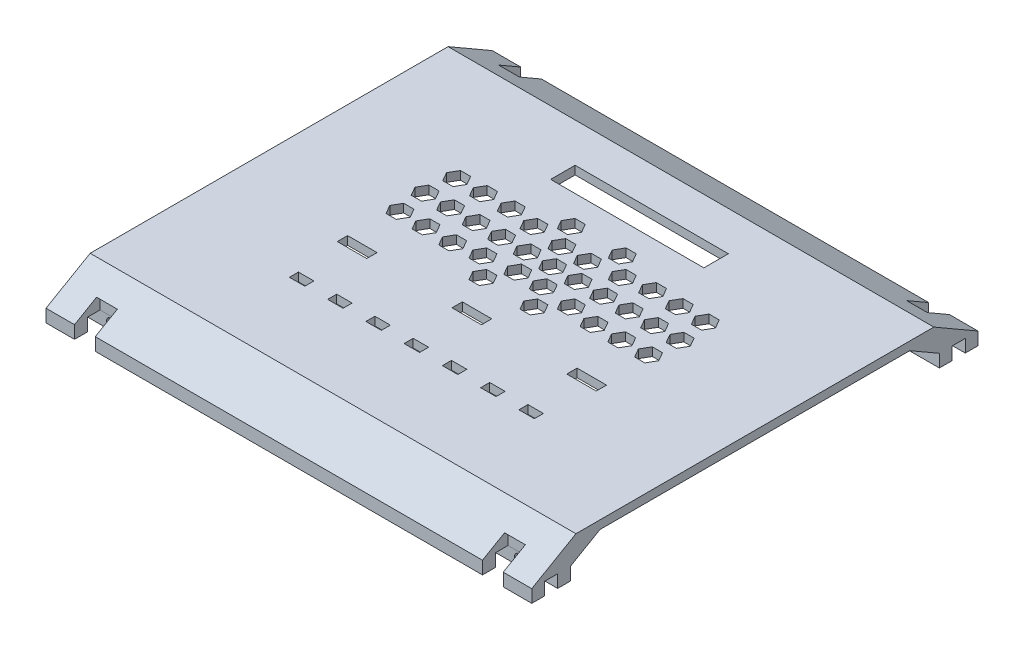
from build123d import *
from OCP.BRepFilletAPI import BRepFilletAPI_MakeChamfer

# Parameters (mm, degrees)
SKETCH1_W           = 190.5
SKETCH1_H           = 175
BOSS_EXTRUDE1_DEPTH = 10
SKETCH2_W           = 190.5
SKETCH2_H           = 5
BOSS_EXTRUDE2_DEPTH = 5
CHAMFER1_SIZE       = 10
CHAMFER1_SIZE2      = 17.320508076
CUT_EXTRUDE1_DEPTH  = 190.5
SKETCH4_R           = 1.65
CUT_EXTRUDE2_DEPTH  = 200.493264297
SKETCH6_W           = 8.137310982
SKETCH6_H           = 10
CUT_EXTRUDE4_DEPTH  = 10
SKETCH7_W           = 6.05
SKETCH7_H           = 3.55
CUT_EXTRUDE5_DEPTH  = 10
LPATTERN1_COUNT     = 7
LPATTERN1_PITCH     = 15
SKETCH8_W           = 11.55
SKETCH8_H           = 4.05
CUT_EXTRUDE6_DEPTH  = 3.301548091
SKETCH9_W           = 60.1
SKETCH9_H           = 9.6
CUT_EXTRUDE7_DEPTH  = 3.301548091
FILL_START          = 6.698451909
FILL_PATTERN1_DEPTH = 3.301548091


# Read off the part's stored shape, not the designer's step: Fill Pattern1
with BuildPart() as part:
    # Sketch1 → Boss-Extrude1 (new body)
    with BuildSketch(Plane(origin=(0, 0, 0), x_dir=(1, 0, 0), z_dir=(0, 1, 0))):
        Rectangle(SKETCH1_W, SKETCH1_H)
    extrude(amount=BOSS_EXTRUDE1_DEPTH)

    # Sketch2 → Boss-Extrude2 (add)
    with BuildSketch(Plane.XZ):
        with Locations((0, 85)):
            Rectangle(SKETCH2_W, SKETCH2_H)
        with Locations((0, 74.85)):
            Rectangle(SKETCH2_W, SKETCH2_H)
    boss_extrude2 = extrude(amount=BOSS_EXTRUDE2_DEPTH)

    # Mirror2: Boss-Extrude2 across plane
    add(boss_extrude2.mirror(Plane.XY))

    # Chamfer1: one chamfer whose edges measure the first distance from different faces: ONE call of the kernel's chamfer builder (chamfer() names one face for all edges)
    chamfer1_edges_1 = [part.edges().sort_by_distance(p)[0] for p in [
        (0, 10, 87.5),
    ]]
    chamfer1_side_1 = [part.faces().sort_by_distance(p)[0] for p in [
        (0, 2.5, 87.5),
    ]]
    chamfer1_edges_2 = [part.edges().sort_by_distance(p)[0] for p in [
        (0, 10, -87.5),
    ]]
    chamfer1_side_2 = [part.faces().sort_by_distance(p)[0] for p in [
        (0, 2.5, -87.5),
    ]]
    chamfer1 = BRepFilletAPI_MakeChamfer(part.part.solid().wrapped)
    for e in chamfer1_edges_1:
        chamfer1.Add(CHAMFER1_SIZE, CHAMFER1_SIZE2, e.wrapped, chamfer1_side_1[0].wrapped)  # the first distance lies on this face
    for e in chamfer1_edges_2:
        chamfer1.Add(CHAMFER1_SIZE, CHAMFER1_SIZE2, e.wrapped, chamfer1_side_2[0].wrapped)  # the first distance lies on this face
    add(Compound.cast(chamfer1.Shape()), mode=Mode.REPLACE)

    # Sketch3 → Cut-Extrude1 (cut)
    with BuildSketch(Plane.ZY.offset(95.25)):
        Polygon((-72.35, 0), (-60.747940961, 6.698451909), (60.747940961, 6.698451909), (72.35, 0), align=None)
    extrude(amount=-CUT_EXTRUDE1_DEPTH, mode=Mode.SUBTRACT)

    # Sketch4 → Cut-Extrude2 (cut, through all)
    with BuildSketch(Plane.XY.offset(87.5)):
        with Locations((-80, -2.5)):
            Circle(SKETCH4_R)
        with Locations((80, -2.5)):
            Circle(SKETCH4_R)
    extrude(amount=-CUT_EXTRUDE2_DEPTH, mode=Mode.SUBTRACT)

    # Sketch6 → Cut-Extrude4 (cut)
    with BuildSketch(Plane(origin=(0, 0, -87.5), x_dir=(-1, 0, 0), z_dir=(0, 0, -1))):
        with Locations((-80, 0)):
            Rectangle(SKETCH6_W, SKETCH6_H)
        with Locations((80, 0)):
            Rectangle(SKETCH6_W, SKETCH6_H)
    cut_extrude4 = extrude(amount=-CUT_EXTRUDE4_DEPTH, mode=Mode.SUBTRACT)

    # Mirror3: Cut-Extrude4 across plane
    add(cut_extrude4.mirror(Plane.XY), mode=Mode.SUBTRACT)

    # Sketch7 → Cut-Extrude5 (cut)
    with BuildSketch(Plane(origin=(0, 10, 0), x_dir=(1, 0, 0), z_dir=(0, 1, 0))):
        with Locations((-45, -37.5)):
            Rectangle(SKETCH7_W, SKETCH7_H)
    cut_extrude5 = extrude(amount=-CUT_EXTRUDE5_DEPTH, mode=Mode.SUBTRACT)

    # LPattern1: Cut-Extrude5 ×7
    with Locations(*[(i * LPATTERN1_PITCH, 0, 0) for i in range(1, LPATTERN1_COUNT)]):
        add(cut_extrude5, mode=Mode.SUBTRACT)

    # Sketch8 → Cut-Extrude6 (cut)
    with BuildSketch(Plane(origin=(0, 10, 0), x_dir=(1, 0, 0), z_dir=(0, 1, 0))):
        with Locations((-45, -15.725)):
            Rectangle(SKETCH8_W, SKETCH8_H)
        with Locations((0, -15.725)):
            Rectangle(SKETCH8_W, SKETCH8_H)
        with Locations((45, -15.725)):
            Rectangle(SKETCH8_W, SKETCH8_H)
    extrude(amount=-CUT_EXTRUDE6_DEPTH, mode=Mode.SUBTRACT)

    # Sketch9 → Cut-Extrude7 (cut)
    with BuildSketch(Plane(origin=(0, 10, 0), x_dir=(1, 0, 0), z_dir=(0, 1, 0))):
        with Locations((0, 50)):
            Rectangle(SKETCH9_W, SKETCH9_H)
    extrude(amount=-CUT_EXTRUDE7_DEPTH, mode=Mode.SUBTRACT)

    # Fill Pattern1 outline → Fill Pattern1 (cut)
    with BuildSketch(Plane(origin=(0, 0, 0), x_dir=(1, 0, 0), z_dir=(0, 1, 0)).offset(FILL_START)):
        Polygon((-4, 15.936317591), (-2, 12.472215975), (2, 12.472215975), (4, 15.936317591), (2, 19.400419206), (-2, 19.400419206), align=None)
        Polygon((-14, 33.256825666), (-12, 29.792724051), (-8, 29.792724051), (-6, 33.256825666), (-8, 36.720927281), (-12, 36.720927281), align=None)
        Polygon((1, 7.276063553), (3, 3.811961938), (7, 3.811961938), (9, 7.276063553), (7, 10.740165168), (3, 10.740165168), align=None)
        Polygon((-9, 24.596571628), (-7, 21.132470013), (-3, 21.132470013), (-1, 24.596571628), (-3, 28.060673243), (-7, 28.060673243), align=None)
        Polygon((6, -1.384190485), (8, -4.8482921), (12, -4.8482921), (14, -1.384190485), (12, 2.07991113), (8, 2.07991113), align=None)
        Polygon((8, 12.472215975), (12, 12.472215975), (14, 15.936317591), (12, 19.400419206), (8, 19.400419206), (6, 15.936317591), align=None)
        Polygon((-12, 12.472215975), (-8, 12.472215975), (-6, 15.936317591), (-8, 19.400419206), (-12, 19.400419206), (-14, 15.936317591), align=None)
        Polygon((-22, 12.472215975), (-18, 12.472215975), (-16, 15.936317591), (-18, 19.400419206), (-22, 19.400419206), (-24, 15.936317591), align=None)
        Polygon((-32, 12.472215975), (-28, 12.472215975), (-26, 15.936317591), (-28, 19.400419206), (-32, 19.400419206), (-34, 15.936317591), align=None)
        Polygon((-42, 12.472215975), (-38, 12.472215975), (-36, 15.936317591), (-38, 19.400419206), (-42, 19.400419206), (-44, 15.936317591), align=None)
        Polygon((-52, 12.472215975), (-48, 12.472215975), (-46, 15.936317591), (-48, 19.400419206), (-52, 19.400419206), (-54, 15.936317591), align=None)
        Polygon((38, 12.472215975), (42, 12.472215975), (44, 15.936317591), (42, 19.400419206), (38, 19.400419206), (36, 15.936317591), align=None)
        Polygon((48, 12.472215975), (52, 12.472215975), (54, 15.936317591), (52, 19.400419206), (48, 19.400419206), (46, 15.936317591), align=None)
        Polygon((18, 12.472215975), (22, 12.472215975), (24, 15.936317591), (22, 19.400419206), (18, 19.400419206), (16, 15.936317591), align=None)
        Polygon((28, 12.472215975), (32, 12.472215975), (34, 15.936317591), (32, 19.400419206), (28, 19.400419206), (26, 15.936317591), align=None)
        Polygon((7, 21.132470013), (9, 24.596571628), (7, 28.060673243), (3, 28.060673243), (1, 24.596571628), (3, 21.132470013), align=None)
        Polygon((-3, 3.811961938), (-1, 7.276063553), (-3, 10.740165168), (-7, 10.740165168), (-9, 7.276063553), (-7, 3.811961938), align=None)
        Polygon((12, 29.792724051), (14, 33.256825666), (12, 36.720927281), (8, 36.720927281), (6, 33.256825666), (8, 29.792724051), align=None)
        Polygon((-8, -4.8482921), (-6, -1.384190485), (-8, 2.07991113), (-12, 2.07991113), (-14, -1.384190485), (-12, -4.8482921), align=None)
        Polygon((-52.746395609, 4.810270893), (-50.746395609, 1.346169278), (-46.746395609, 1.346169278), (-44.746395609, 4.810270893), (-46.746395609, 8.274372508), (-50.746395609, 8.274372508), align=None)
        Polygon((46.746395609, 1.346169278), (50.746395609, 1.346169278), (52.746395609, 4.810270893), (50.746395609, 8.274372508), (46.746395609, 8.274372508), (44.746395609, 4.810270893), align=None)
        Polygon((-42.379718945, 4.667015317), (-40.379718945, 1.202913702), (-36.379718945, 1.202913702), (-34.379718945, 4.667015317), (-36.379718945, 8.131116932), (-40.379718945, 8.131116932), align=None)
        Polygon((36.379718945, 1.202913702), (40.379718945, 1.202913702), (42.379718945, 4.667015317), (40.379718945, 8.131116932), (36.379718945, 8.131116932), (34.379718945, 4.667015317), align=None)
        Polygon((-42.379718945, 27.205619864), (-40.379718945, 23.741518249), (-36.379718945, 23.741518249), (-34.379718945, 27.205619864), (-36.379718945, 30.669721479), (-40.379718945, 30.669721479), align=None)
        Polygon((36.379718945, 23.741518249), (40.379718945, 23.741518249), (42.379718945, 27.205619864), (40.379718945, 30.669721479), (36.379718945, 30.669721479), (34.379718945, 27.205619864), align=None)
        Polygon((-52.746395609, 27.062364288), (-50.746395609, 23.598262673), (-46.746395609, 23.598262673), (-44.746395609, 27.062364288), (-46.746395609, 30.526465903), (-50.746395609, 30.526465903), align=None)
        Polygon((46.746395609, 23.598262673), (50.746395609, 23.598262673), (52.746395609, 27.062364288), (50.746395609, 30.526465903), (46.746395609, 30.526465903), (44.746395609, 27.062364288), align=None)
        Polygon((-31.716385975, 27.416820561), (-29.716385975, 23.952718946), (-25.716385975, 23.952718946), (-23.716385975, 27.416820561), (-25.716385975, 30.880922177), (-29.716385975, 30.880922177), align=None)
        Polygon((25.716385975, 23.952718946), (29.716385975, 23.952718946), (31.716385975, 27.416820561), (29.716385975, 30.880922177), (25.716385975, 30.880922177), (23.716385975, 27.416820561), align=None)
        Polygon((-21.320508076, 25.936317591), (-19.320508076, 22.472215975), (-15.320508076, 22.472215975), (-13.320508076, 25.936317591), (-15.320508076, 29.400419206), (-19.320508076, 29.400419206), align=None)
        Polygon((15.320508076, 22.472215975), (19.320508076, 22.472215975), (21.320508076, 25.936317591), (19.320508076, 29.400419206), (15.320508076, 29.400419206), (13.320508076, 25.936317591), align=None)
        Polygon((-21.320508076, 5.936317591), (-19.320508076, 2.472215975), (-15.320508076, 2.472215975), (-13.320508076, 5.936317591), (-15.320508076, 9.400419206), (-19.320508076, 9.400419206), align=None)
        Polygon((15.320508076, 2.472215975), (19.320508076, 2.472215975), (21.320508076, 5.936317591), (19.320508076, 9.400419206), (15.320508076, 9.400419206), (13.320508076, 5.936317591), align=None)
        Polygon((-31.716385975, 4.45581462), (-29.716385975, 0.991713004), (-25.716385975, 0.991713004), (-23.716385975, 4.45581462), (-25.716385975, 7.919916235), (-29.716385975, 7.919916235), align=None)
        Polygon((25.716385975, 0.991713004), (29.716385975, 0.991713004), (31.716385975, 4.45581462), (29.716385975, 7.919916235), (25.716385975, 7.919916235), (23.716385975, 4.45581462), align=None)
    extrude(amount=FILL_PATTERN1_DEPTH, mode=Mode.SUBTRACT)


solid = part.part
